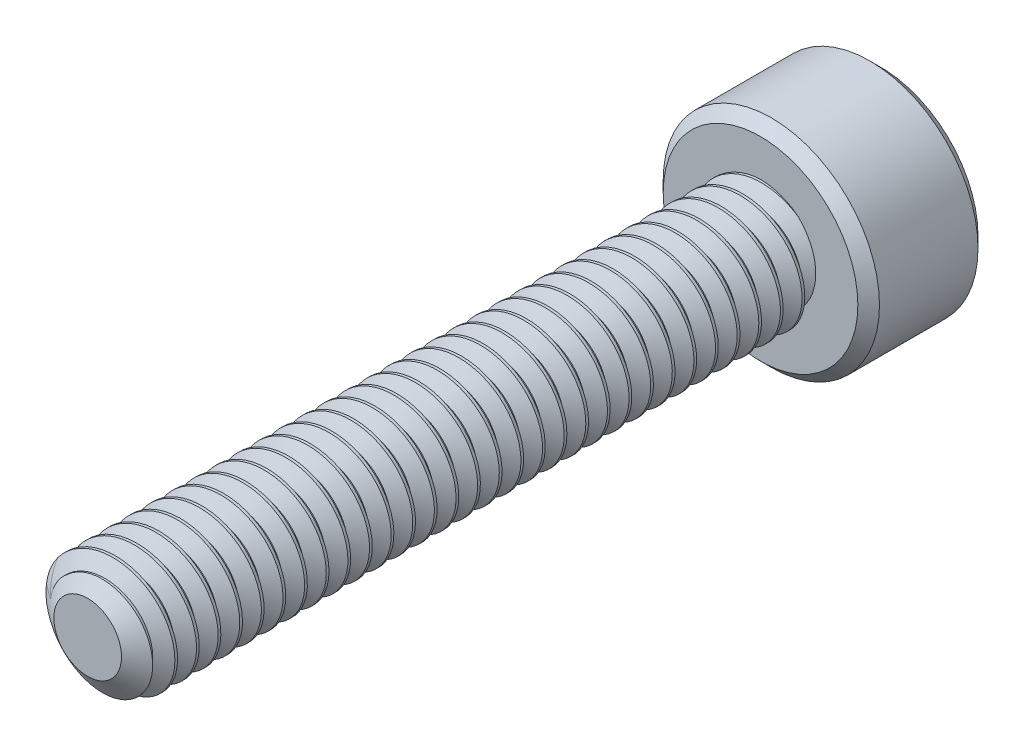
from build123d import *

# Parameters (mm, degrees)
SKETCH1_R          = 1.25
EXTRUDE1_DEPTH     = 14
CUT_SWEEP1_PITCH   = 0.45
SKETCH6_R          = 2.25
EXTRUDE2_DEPTH     = 2.5
CUT_EXTRUDE1_DEPTH = 1.5
CHAMFER1_SIZE      = 0.225


with BuildPart() as part:
    # Sketch1 → Extrude1 (new body)
    with BuildSketch(Plane.XY):
        Circle(SKETCH1_R)
    extrude(amount=-EXTRUDE1_DEPTH)

    # Cut-Sweep1: arcs per turn and ends read off the stored shape
    # Cut-Sweep1: the profile of Sketch3 profile screwed along a right-hand helix through 34 turns, 6 arcs to a turn; built about Z, then put on its axis
    cut_sweep1_z = Axis((0, 0, 0), (0, 0, 1))
    cut_sweep1_corners = [(1.2503, 0, -0.843923205), (0.957716426, 0, -0.675), (0.957716426, 0, -0.61875), (1.2503, 0, -0.449826795)]
    with BuildLine(mode=Mode.PRIVATE) as cut_sweep1_profile:
        Line(cut_sweep1_corners[0], cut_sweep1_corners[1])
        Line(cut_sweep1_corners[1], cut_sweep1_corners[2])
        Line(cut_sweep1_corners[2], cut_sweep1_corners[3])
        Line(cut_sweep1_corners[3], cut_sweep1_corners[0])
    cut_sweep1_cap = Face(cut_sweep1_profile.wire())
    cut_sweep1_turn_angles = [0, 30, 60, 90, 120, 150, 180, 210, 240, 270, 300, 330, 360]
    cut_sweep1_turn_weights = [1, 0.8660254037844387, 1, 0.8660254037844387, 1, 0.8660254037844387, 1, 0.8660254037844387, 1, 0.8660254037844387, 1, 0.8660254037844387, 1]
    cut_sweep1_turn_rails = [Edge.make_bspline([Vector(p[0], p[1], 0).rotate(cut_sweep1_z, cut_sweep1_turn_angles[k]) / cut_sweep1_turn_weights[k] + Vector(0, 0, p[2] + CUT_SWEEP1_PITCH * cut_sweep1_turn_angles[k] / 360) for k in range(13)], [0, 0, 0, 1, 1, 2, 2, 3, 3, 4, 4, 5, 5, 6, 6, 6], 2, cut_sweep1_turn_weights) for p in cut_sweep1_corners]
    cut_sweep1_turn_sides = [Face.make_surface_from_curves(cut_sweep1_turn_rails[p[0]], cut_sweep1_turn_rails[p[1]]) for p in [(0, 1), (1, 2), (2, 3), (3, 0)]]
    cut_sweep1 = Plane(origin=(0, 0, 0), x_dir=(0, 1, 0), z_dir=(0, 0, -1)) * Solid(Shell([*[p.moved(Location((0, 0, CUT_SWEEP1_PITCH * i))) for i in range(34) for p in cut_sweep1_turn_sides], cut_sweep1_cap, cut_sweep1_cap.rotate(cut_sweep1_z, 12240).moved(Location((0, 0, CUT_SWEEP1_PITCH * 12240 / 360)))]))
    add(cut_sweep1, mode=Mode.SUBTRACT)

    # Sketch4 → Cut-Revolve1 (revolve, cut)
    with BuildSketch(Plane(origin=(0, 0, 0), x_dir=(0, 0, -1), z_dir=(1, 0, 0)), mode=Mode.PRIVATE) as cut_revolve1_sk:
        Polygon((0.382511876, 1.25), (0, 0.703716426), (0, 1.25), align=None)
    revolve(cut_revolve1_sk.sketch.rotate(Axis((0, 0, 0), (0, 0, -1)), 276.971148597), axis=Axis((0, 0, 0), (0, 0, -1)), mode=Mode.SUBTRACT)

    # Sketch6 → Extrude2 (add)
    with BuildSketch(Plane(origin=(0, 0, -14), x_dir=(-1, 0, 0), z_dir=(0, 0, -1))):
        with Locations(Location((0, 0, 0), (0, 0, 180))):
            Circle(SKETCH6_R)
    extrude(amount=EXTRUDE2_DEPTH)

    # Sketch7 → Cut-Extrude1 (cut)
    with BuildSketch(Plane(origin=(0, 0, -16.5), x_dir=(-1, 0, 0), z_dir=(0, 0, -1))):
        Polygon((0, 1.154700538), (-1, 0.577350269), (-1, -0.577350269), (0, -1.154700538), (1, -0.577350269), (1, 0.577350269), align=None)
    extrude(amount=-CUT_EXTRUDE1_DEPTH, mode=Mode.SUBTRACT)

    # Cut-Extrude2 cone 1 section (through the dimple's axis) → Cut-Extrude2 (revolve, cut)
    with BuildSketch(Plane(origin=(0, 0, -16.5), x_dir=(0, 1, 0), z_dir=(1, 0, 0))):
        Polygon((0, 0), (1.154700538, 0), (0, 1.154700538), align=None)
    revolve(axis=Axis((0, 0, -16.5), (0, 0, 1)), mode=Mode.SUBTRACT)

    # Chamfer1
    chamfer1_edges = [part.edges().sort_by_distance(p)[0] for p in [
        (-2.25, 0, -14),
        (-2.25, 0, -16.5),
    ]]
    chamfer(chamfer1_edges, length=CHAMFER1_SIZE)


solid = part.part
